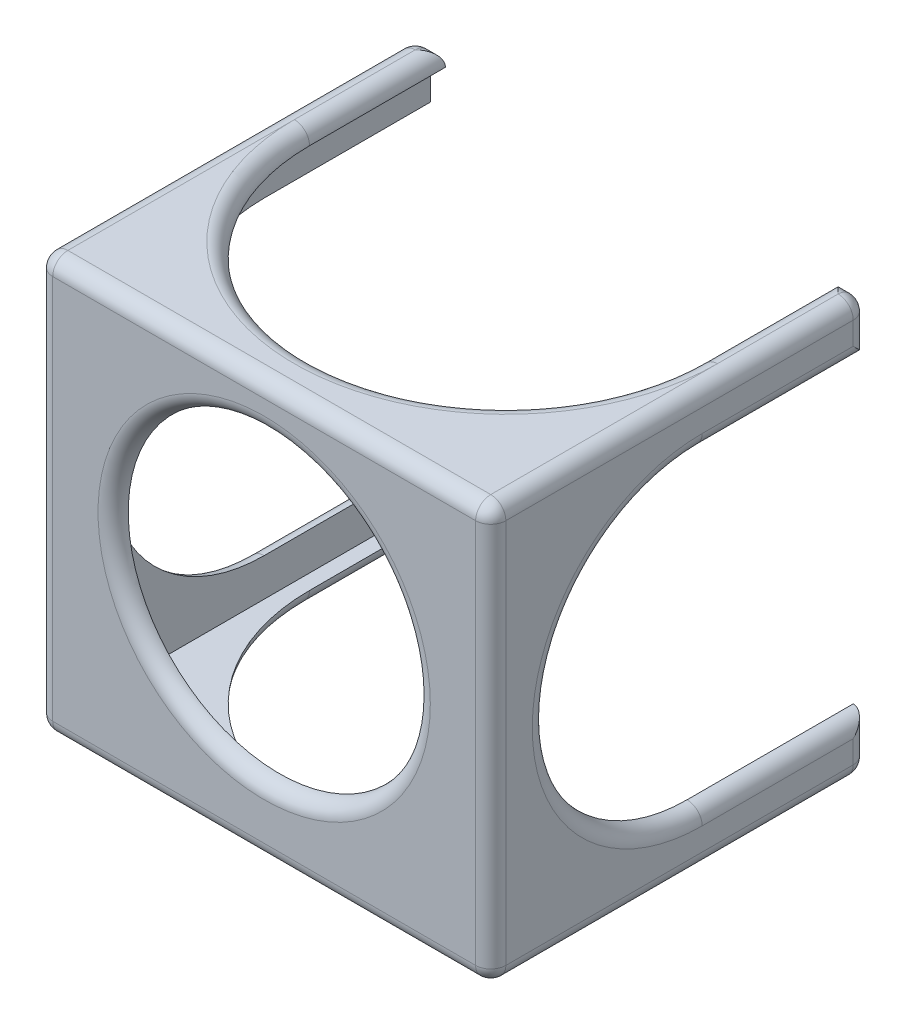
from build123d import *

# Parameters (mm, degrees)
SKETCH_1_W          = 60
SKETCH_1_H          = 55
SKETCH_1_R          = 20
EXTRUDE_1_DEPTH     = 2
SKETCH_2_W          = 60
SKETCH_2_H          = 55
SKETCH_2_W_2        = 56
SKETCH_2_H_2        = 51
EXTRUDE_2_DEPTH     = 48
CUT_EXTRUDE_1_REACH = 96.493
CUT_EXTRUDE_2_REACH = 96.493
FILLET_1_R          = 2


with BuildPart() as part:
    # 草图1 → 凸台-拉伸1 (new body)
    with BuildSketch(Plane.XY):
        with Locations((30, -27.5)):
            Rectangle(SKETCH_1_W, SKETCH_1_H)
        with Locations((30, -26)):
            Circle(SKETCH_1_R, mode=Mode.SUBTRACT)
    extrude(amount=EXTRUDE_1_DEPTH)

    # 草图2 → 凸台-拉伸2 (add)
    with BuildSketch(Plane(origin=(0, 0, 0), x_dir=(-1, 0, 0), z_dir=(0, 0, -1))):
        with Locations((-30, -27.5)):
            Rectangle(SKETCH_2_W, SKETCH_2_H)
        with Locations((-30, -27.5)):
            Rectangle(SKETCH_2_W_2, SKETCH_2_H_2, mode=Mode.SUBTRACT)
    extrude(amount=EXTRUDE_2_DEPTH)

    # 切除-拉伸1: up to this face of the body (flat: up to its plane)
    cut_extrude_1_end = Plane(part.part.faces().sort_by_distance((30, 0, -23))[0])
    # 草图3 → 切除-拉伸1 (cut, up to the picked face)
    with BuildSketch(Plane.XZ.offset(55), mode=Mode.PRIVATE) as cut_extrude_1_sk1:
        with BuildLine():
            Line((30, -48), (4, -48))
            Line((4, -48), (4, -30))
            ThreePointArc((4, -30), (30, -4), (56, -30))
            Line((56, -30), (56, -48))
            Line((56, -48), (30, -48))
        make_face()
    cut_extrude_1_tool1 = split(extrude(cut_extrude_1_sk1.sketch, amount=-CUT_EXTRUDE_1_REACH, mode=Mode.PRIVATE), bisect_by=cut_extrude_1_end, keep=Keep.BOTH, mode=Mode.PRIVATE)
    add(cut_extrude_1_tool1.solids().sort_by(Axis((30, -55, -28.351568), (0, 1, 0)))[0], mode=Mode.SUBTRACT)

    # 切除-拉伸2: up to this face of the body (flat: up to its plane)
    cut_extrude_2_end = Plane(part.part.faces().sort_by_distance((60, -27.5, -23))[0])
    # 草图4 → 切除-拉伸2 (cut, up to the picked face)
    with BuildSketch(Plane.ZY, mode=Mode.PRIVATE) as cut_extrude_2_sk1:
        with BuildLine():
            Line((-26, -7), (-48, -7))
            Line((-48, -7), (-48, -48))
            Line((-48, -48), (-26, -48))
            ThreePointArc((-26, -48), (-5.5, -27.5), (-26, -7))
        make_face()
    cut_extrude_2_tool1 = split(extrude(cut_extrude_2_sk1.sketch, amount=-CUT_EXTRUDE_2_REACH, mode=Mode.PRIVATE), bisect_by=cut_extrude_2_end, keep=Keep.BOTH, mode=Mode.PRIVATE)
    add(cut_extrude_2_tool1.solids().sort_by(Axis((0, -27.5, -28.674932), (1, 0, 0)))[0], mode=Mode.SUBTRACT)

    # 圆角1
    fillet_1_edges = [part.edges().sort_by_distance(p)[0] for p in [
        (56, 0, -39),
        (58, 0, -48),
        (2, 0, -48),
        (4, 0, -39),
        (30, 0, -4),
        (0, -7, -37),
        (0, -3.5, -48),
        (0, 0, -23),
        (0, -51.5, -48),
        (0, -48, -37),
        (0, -27.5, -5.5),
        (10, -26, 2),
        (30, 0, 2),
        (0, -27.5, 2),
        (60, -27.5, 2),
        (60, 0, -23),
        (60, -3.5, -48),
        (60, -7, -37),
        (60, -27.5, -5.5),
        (60, -48, -37),
        (60, -51.5, -48),
        (0, -55, -23),
        (30, -55, 2),
        (60, -55, -23),
        (58, -55, -48),
        (56, -55, -39),
        (30, -55, -4),
        (4, -55, -39),
        (2, -55, -48),
    ]]
    fillet(fillet_1_edges, radius=FILLET_1_R - 0.0001)  # a hair under: the kernel refuses the full size


solid = part.part
